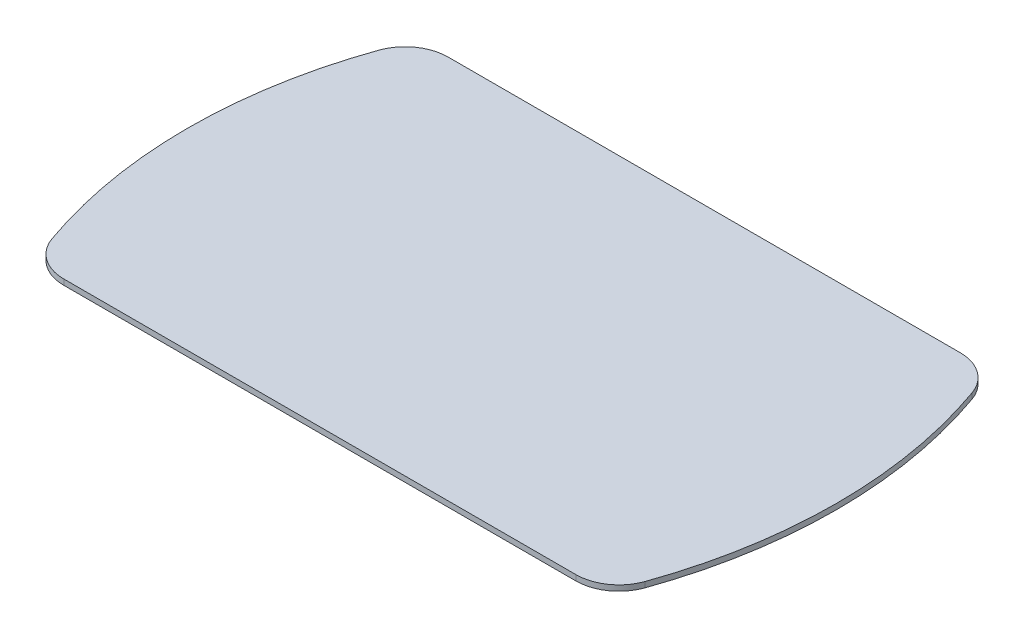
from build123d import *

# Parameters (mm, degrees)
BOSS_EXTRUDE1_DEPTH = 0.5


with BuildPart() as part:
    # Sketch1 → Boss-Extrude1 (new body)
    with BuildSketch(Plane.XZ):
        with BuildLine():
            Line((23.183766184, 17.4), (-23.183766184, 17.4))
            ThreePointArc((-23.183766184, 17.4), (-25.435432234, 16.684336666), (-26.860721446, 14.8))
            ThreePointArc((-26.860721446, 14.8), (-29.4, 0), (-26.860721446, -14.8))
            ThreePointArc((-26.860721446, -14.8), (-25.435432234, -16.684336666), (-23.183766184, -17.4))
            Line((-23.183766184, -17.4), (23.183766184, -17.4))
            ThreePointArc((23.183766184, -17.4), (25.435432234, -16.684336666), (26.860721446, -14.8))
            ThreePointArc((26.860721446, -14.8), (29.4, 0), (26.860721446, 14.8))
            ThreePointArc((26.860721446, 14.8), (25.435432234, 16.684336666), (23.183766184, 17.4))
        make_face()
    extrude(amount=-BOSS_EXTRUDE1_DEPTH)


solid = part.part
